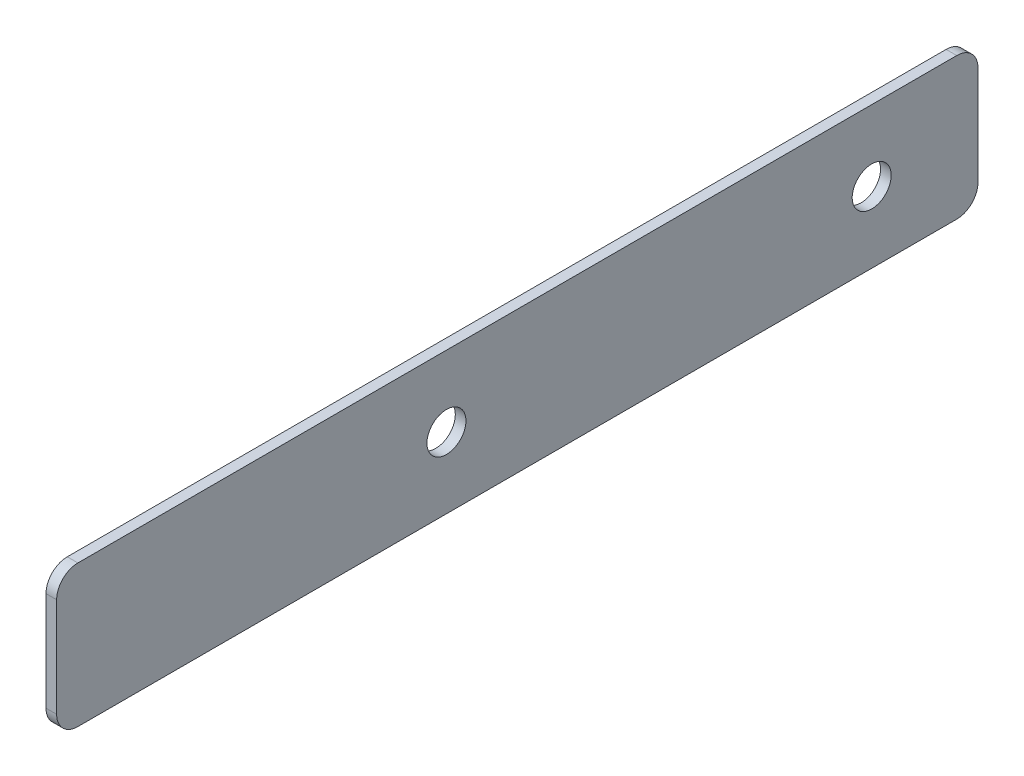
from build123d import *

# Parameters (mm, degrees)
SZKIC1_W                = 130
SZKIC1_H                = 20
ODGI_CIE_BAZOWE1_DEPTH  = 1.5
OTW_R_POD_RUB_M51_D     = 5.5
OTW_R_POD_RUB_M51_DEPTH = 10
OTW_R_POD_RUB_M51_TIP   = 1.652366702
ZAOKR_GLENIE1_R         = 3


# Sheet-metal steps are written as plain solids
with BuildPart() as part:
    # Szkic1 → Odgięcie bazowe1 (new body)
    with BuildSketch(Plane(origin=(0, 0, 0), x_dir=(0, 0, -1), z_dir=(1, 0, 0))):
        Rectangle(SZKIC1_W, SZKIC1_H)
    extrude(amount=-ODGI_CIE_BAZOWE1_DEPTH)

    # Otwór pod śrubę M51
    with Locations(Plane(origin=(0, 0, 0), x_dir=(0, 0, -1), z_dir=(1, 0, 0))):
        with Locations((-10, 0), (50, 0)):
            Hole(OTW_R_POD_RUB_M51_D / 2, depth=OTW_R_POD_RUB_M51_DEPTH)
            with Locations((0, 0, -(OTW_R_POD_RUB_M51_DEPTH + OTW_R_POD_RUB_M51_TIP / 2))):  # 118° drill point
                Cone(0, OTW_R_POD_RUB_M51_D / 2, OTW_R_POD_RUB_M51_TIP, mode=Mode.SUBTRACT)

    # Zaokrąglenie1
    zaokr_glenie1_edges = [part.edges().sort_by_distance(p)[0] for p in [
        (-0.75, -10, -65),
        (-0.75, -10, 65),
        (-0.75, 10, 65),
        (-0.75, 10, -65),
    ]]
    fillet(zaokr_glenie1_edges, radius=ZAOKR_GLENIE1_R)


solid = part.part
